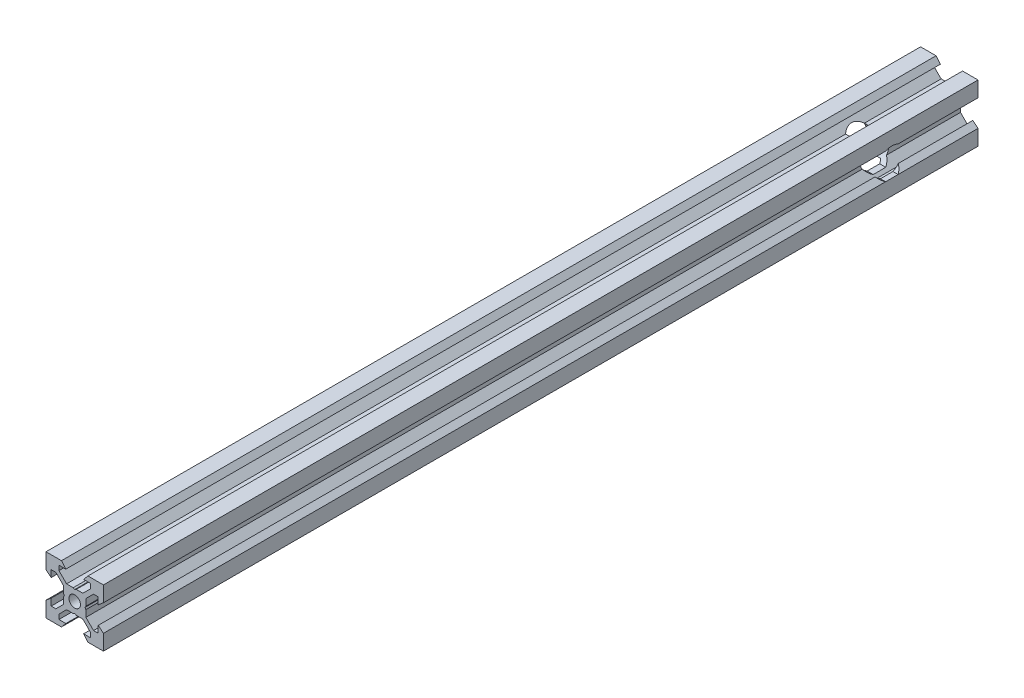
from build123d import *

# Parameters (mm, degrees)
SKETCH1_R           = 2
BOSS_EXTRUDE1_DEPTH = 304.65
CUT_EXTRUDE1_START  = -20
CUT_EXTRUDE1_DEPTH  = 20
CUT_EXTRUDE2_START  = -304.65
SKETCH4_R           = 2
CUT_EXTRUDE2_DEPTH  = 304.65


# Read off the part's stored shape, not the designer's step: Cut-Extrude1
with BuildPart() as part:
    # Sketch1 → Boss-Extrude1 (new, symmetric)
    with BuildSketch(Plane.XY):
        Polygon((10, 10), (10, 4.610379336), (8.2, 3.1), (8.2, 5.5), (6.560660172, 5.5), (3.9, 2.839339828), (3.9, 0.519615242), (3.6, 0), (3.9, -0.519615242), (3.9, -2.839339828), (6.560660172, -5.5), (8.2, -5.5), (8.2, -3.1), (10, -4.610379336), (10, -10), (4.610379336, -10), (3.1, -8.2), (5.5, -8.2), (5.5, -6.560660172), (2.839339828, -3.9), (0.519615242, -3.9), (0, -3.6), (-0.519615242, -3.9), (-2.839339828, -3.9), (-5.5, -6.560660172), (-5.5, -8.2), (-3.1, -8.2), (-4.610379336, -10), (-10, -10), (-10, -4.610379336), (-8.2, -3.1), (-8.2, -5.5), (-6.560660172, -5.5), (-3.9, -2.839339828), (-3.9, -0.519615242), (-3.6, 0), (-3.9, 0.519615242), (-3.9, 2.839339828), (-6.560660172, 5.5), (-8.2, 5.5), (-8.2, 3.1), (-10, 4.610379336), (-10, 10), (-4.610379336, 10), (-3.1, 8.2), (-5.5, 8.2), (-5.5, 6.560660172), (-2.839339828, 3.9), (-0.519615242, 3.9), (0, 3.6), (0.519615242, 3.9), (2.839339828, 3.9), (5.5, 6.560660172), (5.5, 8.2), (3.1, 8.2), (4.610379336, 10), align=None)
        with Locations(Location((0, 0, 0), (0, 0, 180))):
            Circle(SKETCH1_R, mode=Mode.SUBTRACT)
    extrude(amount=BOSS_EXTRUDE1_DEPTH, both=True)

    # Cut-Extrude1 outline → Cut-Extrude1 (cut)
    with BuildSketch(Plane(origin=(10, 0, 0), x_dir=(0, 0, -1), z_dir=(1, 0, 0)).offset(CUT_EXTRUDE1_START)):
        with BuildLine():
            Line((272.469540788, -4.610379336), (276.830459212, -4.610379336))
            ThreePointArc((276.830459212, -4.610379336), (279.606428288, -1.201590041), (278.699691346, 3.1))
            ThreePointArc((278.699691346, 3.1), (274.65, 5.1), (270.600308654, 3.1))
            ThreePointArc((270.600308654, 3.1), (269.693571712, -1.201590041), (272.469540788, -4.610379336))
        make_face()
    extrude(amount=CUT_EXTRUDE1_DEPTH, mode=Mode.SUBTRACT)

    # Sketch4 → Cut-Extrude2 (cut)
    with BuildSketch(Plane.XY.offset(304.65).offset(CUT_EXTRUDE2_START)):
        Polygon((-5.5, 6.560660172), (-5.5, 8.2), (-3.1, 8.2), (-4.610379336, 10), (-10, 10), (-10, 4.610379336), (-8.2, 3.1), (-8.2, 5.5), (-6.560660172, 5.5), (-3.9, 2.839339828), (-3.9, 0.519615242), (-3.6, 0), (-3.9, -0.519615242), (-3.9, -2.839339828), (-6.560660172, -5.5), (-8.2, -5.5), (-8.2, -3.1), (-10, -4.610379336), (-10, -10), (-4.610379336, -10), (-3.1, -8.2), (-5.5, -8.2), (-5.5, -6.560660172), (-2.839339828, -3.9), (-0.519615242, -3.9), (0, -3.6), (0.519615242, -3.9), (2.839339828, -3.9), (5.5, -6.560660172), (5.5, -8.2), (3.1, -8.2), (4.610379336, -10), (10, -10), (10, -4.610379336), (8.2, -3.1), (8.2, -5.5), (6.560660172, -5.5), (3.9, -2.839339828), (3.9, -0.519615242), (3.6, 0), (3.9, 0.519615242), (3.9, 2.839339828), (6.560660172, 5.5), (8.2, 5.5), (8.2, 3.1), (10, 4.610379336), (10, 10), (4.610379336, 10), (3.1, 8.2), (5.5, 8.2), (5.5, 6.560660172), (2.839339828, 3.9), (0.519615242, 3.9), (0, 3.6), (-0.519615242, 3.9), (-2.839339828, 3.9), align=None)
        with Locations(Location((0, 0, 0), (0, 0, 180))):
            Circle(SKETCH4_R, mode=Mode.SUBTRACT)
    extrude(amount=CUT_EXTRUDE2_DEPTH, mode=Mode.SUBTRACT)


solid = part.part
